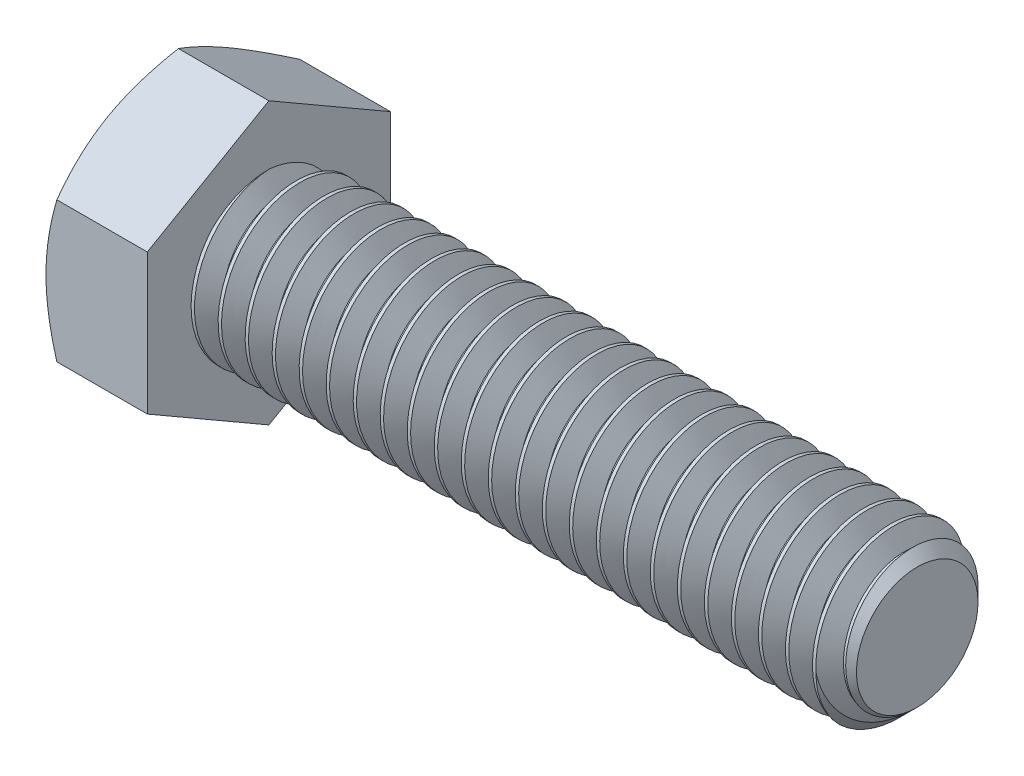
from build123d import *

# Parameters (mm, degrees)
SKETCH5_R           = 4.7625
BOSS_EXTRUDE3_DEPTH = 38.1
CHAMFER1_SIZE       = 1.190625
CUT_SWEEP1_PITCH    = 1.5875
BOSS_EXTRUDE4_DEPTH = 5.953125
SKETCH8_OUTSIDE_W   = 186.802
SKETCH8_OUTSIDE_H   = 189.012
SKETCH8_OUTSIDE_R   = 7.14375
CUT_EXTRUDE3_DEPTH  = 46.384526184
CUT_EXTRUDE3_DRAFT  = -60


with BuildPart() as part:
    # Sketch5 → Boss-Extrude3 (new body)
    with BuildSketch(Plane(origin=(22.0265625, 0, 0), x_dir=(0, 0, -1), z_dir=(1, 0, 0))):
        Circle(SKETCH5_R)
    extrude(amount=-BOSS_EXTRUDE3_DEPTH)

    # Chamfer1
    chamfer1_edges = [part.edges().sort_by_distance(p)[0] for p in [
        (22.0265625, 0, 4.7625),
    ]]
    chamfer(chamfer1_edges, length=CHAMFER1_SIZE)

    # Cut-Sweep1: arcs per turn and ends read off the stored shape
    # Cut-Sweep1: the profile of Sketch10 profile screwed along a right-hand helix through 25 turns, 8 arcs to a turn; built about Z, then put on its axis
    cut_sweep1_z = Axis((0, 0, 0), (0, 0, 1))
    cut_sweep1_corners = [(4.7628, 0, 0.000173205), (3.731388504, 0, -0.5953125), (3.731388504, 0, -0.79375), (4.7628, 0, -1.389235705)]
    with BuildLine(mode=Mode.PRIVATE) as cut_sweep1_profile:
        Line(cut_sweep1_corners[0], cut_sweep1_corners[1])
        Line(cut_sweep1_corners[1], cut_sweep1_corners[2])
        Line(cut_sweep1_corners[2], cut_sweep1_corners[3])
        Line(cut_sweep1_corners[3], cut_sweep1_corners[0])
    cut_sweep1_cap = Face(cut_sweep1_profile.wire())
    cut_sweep1_turn_angles = [0, 22.5, 45, 67.5, 90, 112.5, 135, 157.5, 180, 202.5, 225, 247.5, 270, 292.5, 315, 337.5, 360]
    cut_sweep1_turn_weights = [1, 0.9238795325112867, 1, 0.9238795325112867, 1, 0.9238795325112867, 1, 0.9238795325112867, 1, 0.9238795325112867, 1, 0.9238795325112867, 1, 0.9238795325112867, 1, 0.9238795325112867, 1]
    cut_sweep1_turn_rails = [Edge.make_bspline([Vector(p[0], p[1], 0).rotate(cut_sweep1_z, cut_sweep1_turn_angles[k]) / cut_sweep1_turn_weights[k] + Vector(0, 0, p[2] + CUT_SWEEP1_PITCH * cut_sweep1_turn_angles[k] / 360) for k in range(17)], [0, 0, 0, 1, 1, 2, 2, 3, 3, 4, 4, 5, 5, 6, 6, 7, 7, 8, 8, 8], 2, cut_sweep1_turn_weights) for p in cut_sweep1_corners]
    cut_sweep1_turn_sides = [Face.make_surface_from_curves(cut_sweep1_turn_rails[p[0]], cut_sweep1_turn_rails[p[1]]) for p in [(0, 1), (1, 2), (2, 3), (3, 0)]]
    cut_sweep1 = Plane(origin=(22.0265625, 0, 0), x_dir=(0, 1, 0), z_dir=(-1, 0, 0)) * Solid(Shell([*[p.moved(Location((0, 0, CUT_SWEEP1_PITCH * i))) for i in range(25) for p in cut_sweep1_turn_sides], cut_sweep1_cap, cut_sweep1_cap.rotate(cut_sweep1_z, 9000).moved(Location((0, 0, CUT_SWEEP1_PITCH * 9000 / 360)))]))
    add(cut_sweep1, mode=Mode.SUBTRACT)

    # Sketch6 → Boss-Extrude4 (add)
    with BuildSketch(Plane.ZY.offset(16.0734375)):
        Polygon((7.14375, 4.124445986), (0, 8.248891971), (-7.14375, 4.124445986), (-7.14375, -4.124445986), (0, -8.248891971), (7.14375, -4.124445986), align=None)
    extrude(amount=BOSS_EXTRUDE4_DEPTH)


with BuildPart() as cut_extrude3_tool:
    # Sketch8 outside → Cut-Extrude3 (with draft: the straight prism first)
    with BuildSketch(Plane.ZY.offset(22.0265625)):
        Rectangle(SKETCH8_OUTSIDE_W, SKETCH8_OUTSIDE_H)
        Circle(SKETCH8_OUTSIDE_R, mode=Mode.SUBTRACT)
    extrude(amount=-CUT_EXTRUDE3_DEPTH)
    # Cut-Extrude3: the draft: its side faces are tilted about the plane it starts from
    cut_extrude3_sides = [cut_extrude3_tool.faces().sort_by_distance(p)[0] for p in [
        (1.165700592, -94.506, 0),
        (1.165700592, 0, 93.401),
        (1.165700592, 94.506, 0),
        (1.165700592, 0, -93.401),
        (1.165700592, 0, -7.14375),
    ]]
    draft(cut_extrude3_sides, Plane.ZY.offset(22.0265625), CUT_EXTRUDE3_DRAFT)


with BuildPart() as part_1:
    add(part.part)

    # Cut-Extrude3: cut by cut_extrude3_tool
    add(cut_extrude3_tool.part, mode=Mode.SUBTRACT)


solid = part_1.part
